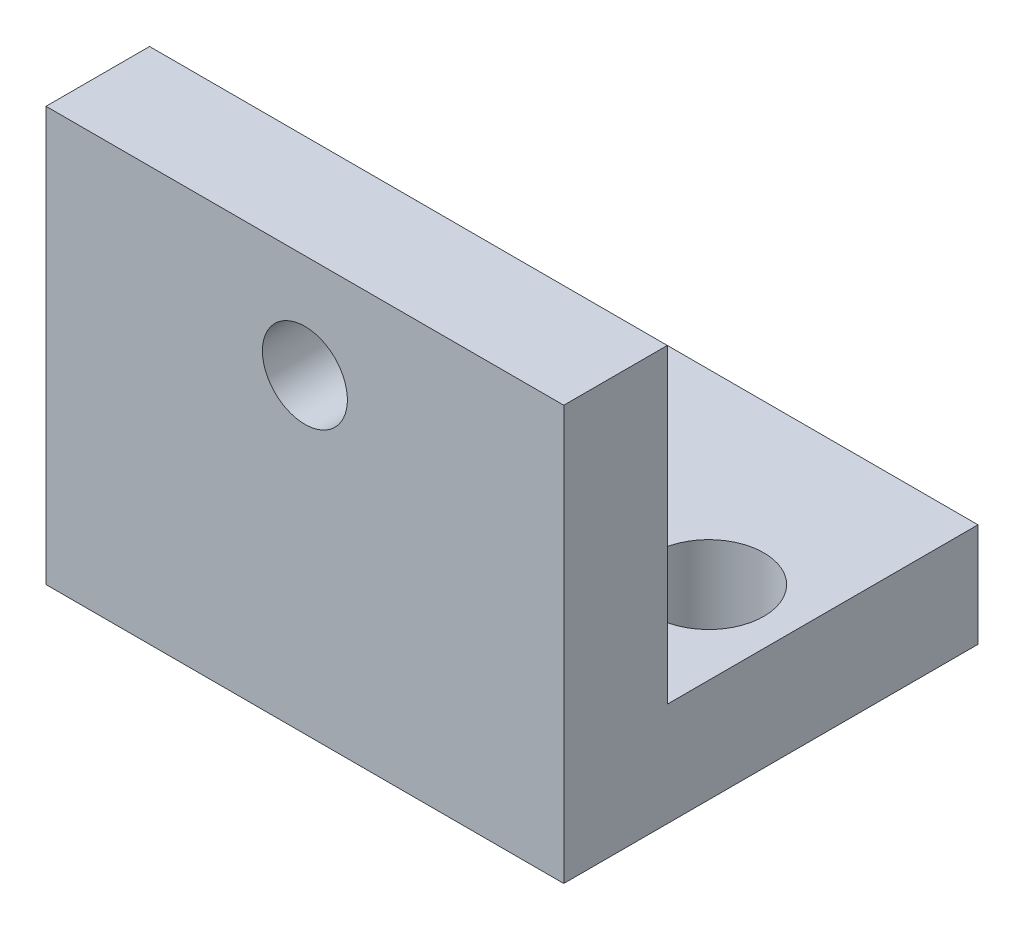
from build123d import *

# Parameters (mm, degrees)
BOSS_EXTRUDE1_DEPTH = 31.75
SKETCH3_R           = 2.6035
CUT_EXTRUDE1_DEPTH  = 45.901280605
SKETCH4_R           = 3.3782
CUT_EXTRUDE2_DEPTH  = 45.901280605


with BuildPart() as part:
    # Sketch2 → Boss-Extrude1 (new body)
    with BuildSketch(Plane(origin=(0, 0, 0), x_dir=(0, 0, -1), z_dir=(1, 0, 0))):
        Polygon((0, 0), (25.4, 0), (25.4, 6.35), (6.35, 6.35), (6.35, 25.4), (0, 25.4), align=None)
    extrude(amount=BOSS_EXTRUDE1_DEPTH)

    # Sketch3 → Cut-Extrude1 (cut, through all)
    with BuildSketch(Plane(origin=(0, 0, -6.35), x_dir=(-1, 0, 0), z_dir=(0, 0, -1))):
        with Locations((-15.875, 19.05)):
            Circle(SKETCH3_R)
    extrude(amount=-CUT_EXTRUDE1_DEPTH, mode=Mode.SUBTRACT)

    # Sketch4 → Cut-Extrude2 (cut, through all)
    with BuildSketch(Plane(origin=(0, 6.35, 0), x_dir=(1, 0, 0), z_dir=(0, 1, 0))):
        with Locations((5.08, 17.78)):
            Circle(SKETCH4_R)
        with Locations((26.67, 13.97)):
            Circle(SKETCH4_R)
    extrude(amount=-CUT_EXTRUDE2_DEPTH, mode=Mode.SUBTRACT)


solid = part.part
